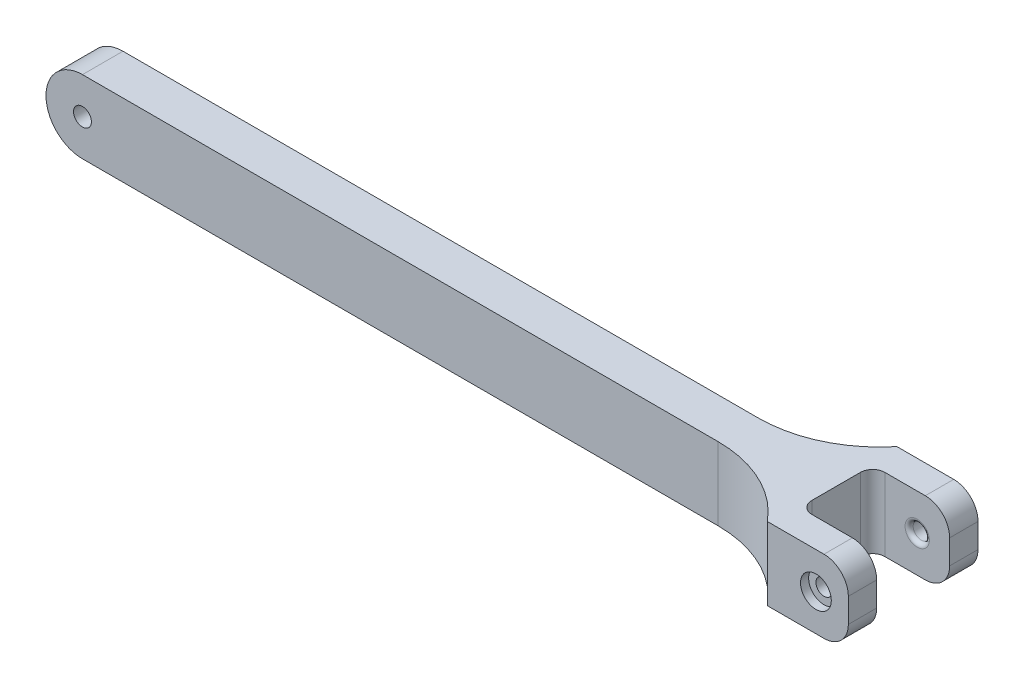
from build123d import *

# Parameters (mm, degrees)
SKETCH1_R           = 1.1
BOSS_EXTRUDE1_DEPTH = 5
BOSS_EXTRUDE2_DEPTH = 9
FILLET1_R           = 15
SKETCH3_R           = 1
CUT_EXTRUDE1_DEPTH  = 16
FILLET2_R           = 3
SKETCH4_R           = 1.9
CUT_EXTRUDE2_DEPTH  = 1
FILLET3_R           = 1.5
FILLET4_R           = 0.5


with BuildPart() as part:
    # Sketch1 → Boss-Extrude1 (new body)
    with BuildSketch(Plane.XY):
        with BuildLine():
            ThreePointArc((0, 4.5), (-4.5, 0), (0, -4.5))
            Line((0, -4.5), (90, -4.5))
            Line((90, -4.5), (90, 4.5))
            Line((90, 4.5), (0, 4.5))
        make_face()
        Circle(SKETCH1_R, mode=Mode.SUBTRACT)
    extrude(amount=BOSS_EXTRUDE1_DEPTH)

    # Sketch2 → Boss-Extrude2 (add)
    with BuildSketch(Plane(origin=(0, 4.5, 0), x_dir=(1, 0, 0), z_dir=(0, 1, 0))):
        Polygon((90.5, 2), (100, 2), (100, 5.5), (90, 5.5), (90, 0), (90, -5), (90, -10.5), (100, -10.5), (100, -7), (90.5, -7), align=None)
    extrude(amount=-BOSS_EXTRUDE2_DEPTH)

    # Fillet1
    # the kernel refuses this fillet: 15 mm, written as the material it adds along each edge
    with BuildSketch(Plane(origin=(90, -4.5, 0), x_dir=(0, 0, -1), z_dir=(0, 1, 0))) as fillet1_piece_1:
        with BuildLine():
            CenterArc((15, 11.608186766), FILLET1_R, 180, 50.703519761)
            Line((0, 11.608186766), (-0.3, 11.608186766))
            Line((-0.3, 11.608186766), (-0.3, 0))
            Line((-0.3, 0), (0, -0.3))
            ThreePointArc((0, -0.3), (2.75, -0.3), (5.31, -0.232163735))
            Line((5.31, -0.232163735), (5.5, 0))
        make_face()
    extrude(amount=9)
    with BuildSketch(Plane(origin=(90, -4.5, 5), x_dir=(0, 0, 1), z_dir=(0, 1, 0))) as fillet1_piece_2:
        with BuildLine():
            CenterArc((15, -11.608186766), FILLET1_R, 129.296480239, 50.703519761)
            Line((0, -11.608186766), (-0.3, -11.608186766))
            Line((-0.3, -11.608186766), (-0.3, 0))
            Line((-0.3, 0), (0, 0.3))
            ThreePointArc((0, 0.3), (2.75, 0.3), (5.31, 0.232163735))
            Line((5.31, 0.232163735), (5.5, 0))
        make_face()
    extrude(amount=9)

    # Sketch3 → Cut-Extrude1 (cut)
    with BuildSketch(Plane.XY.offset(10.5)):
        with Locations((96, 0)):
            Circle(SKETCH3_R)
    extrude(amount=-CUT_EXTRUDE1_DEPTH, mode=Mode.SUBTRACT)

    # Fillet2
    fillet2_edges = [part.edges().sort_by_distance(p)[0] for p in [
        (100, 4.5, 8.75),
        (100, 4.5, -3.75),
        (100, -4.5, 8.75),
        (100, -4.5, -3.75),
    ]]
    fillet(fillet2_edges, radius=FILLET2_R)

    # Sketch4 → Cut-Extrude2 (cut)
    with BuildSketch(Plane.XY.offset(10.5)):
        with Locations((96, 0)):
            Circle(SKETCH4_R)
    extrude(amount=-CUT_EXTRUDE2_DEPTH, mode=Mode.SUBTRACT)

    # Fillet3
    fillet3_edges = [part.edges().sort_by_distance(p)[0] for p in [
        (90.5, 0, 7),
        (90.5, 0, -2),
    ]]
    fillet(fillet3_edges, radius=FILLET3_R)

    # Fillet4
    fillet4_edges = [part.edges().sort_by_distance(p)[0] for p in [
        (95, 0, -2),
    ]]
    fillet(fillet4_edges, radius=FILLET4_R)


solid = part.part
